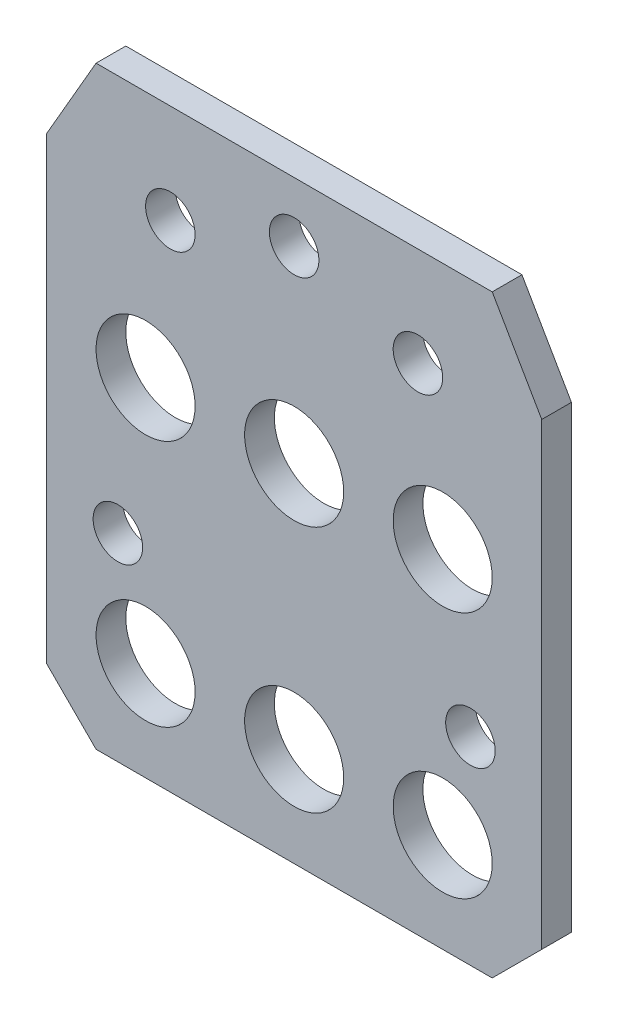
from build123d import *

# Parameters (mm, degrees)
SM_BASE_FLANGE_1_DEPTH = 3
CUT_EXTRUDE_1_REACH    = 41.166
SKETCH_6_R             = 2.5
CUT_EXTRUDE_2_REACH    = 41.166
SKETCH_7_R             = 5


# Sheet-metal steps are written as plain solids
with BuildPart() as part:
    # Sketch 1 → 基体-法兰1 (new body)
    with BuildSketch(Plane.XY):
        Polygon((20, -30), (14.284239003, -30), (-14.284239003, -30), (-20, -30), (-25, -25), (-25, 21.339745962), (-20, 30), (20, 30), (25, 21.339745962), (25, -25), align=None)
    extrude(amount=-SM_BASE_FLANGE_1_DEPTH)

    # 草图6 → 切除-拉伸1 (cut, up to next)
    with BuildSketch(Plane.XY, mode=Mode.PRIVATE) as cut_extrude_1_sk1:
        with Locations((0, 24)):
            Circle(SKETCH_6_R)
    cut_extrude_1_tool1 = extrude(cut_extrude_1_sk1.sketch, amount=-CUT_EXTRUDE_1_REACH, mode=Mode.PRIVATE) & part.part
    # 草图6 → 切除-拉伸1 (cut, up to next)
    with BuildSketch(Plane.XY, mode=Mode.PRIVATE) as cut_extrude_1_sk2:
        with Locations((-17.8, -10)):
            Circle(SKETCH_6_R)
    cut_extrude_1_tool2 = extrude(cut_extrude_1_sk2.sketch, amount=-CUT_EXTRUDE_1_REACH, mode=Mode.PRIVATE) & part.part
    # 草图6 → 切除-拉伸1 (cut, up to next)
    with BuildSketch(Plane.XY, mode=Mode.PRIVATE) as cut_extrude_1_sk3:
        with Locations((17.8, -10)):
            Circle(SKETCH_6_R)
    cut_extrude_1_tool3 = extrude(cut_extrude_1_sk3.sketch, amount=-CUT_EXTRUDE_1_REACH, mode=Mode.PRIVATE) & part.part
    # 草图6 → 切除-拉伸1 (cut, up to next)
    with BuildSketch(Plane.XY, mode=Mode.PRIVATE) as cut_extrude_1_sk4:
        with Locations((-12.5, 20)):
            Circle(SKETCH_6_R)
    cut_extrude_1_tool4 = extrude(cut_extrude_1_sk4.sketch, amount=-CUT_EXTRUDE_1_REACH, mode=Mode.PRIVATE) & part.part
    # 草图6 → 切除-拉伸1 (cut, up to next)
    with BuildSketch(Plane.XY, mode=Mode.PRIVATE) as cut_extrude_1_sk5:
        with Locations((12.5, 20)):
            Circle(SKETCH_6_R)
    cut_extrude_1_tool5 = extrude(cut_extrude_1_sk5.sketch, amount=-CUT_EXTRUDE_1_REACH, mode=Mode.PRIVATE) & part.part
    add(cut_extrude_1_tool1.solids().sort_by_distance((0, 24, 0))[0], mode=Mode.SUBTRACT)
    add(cut_extrude_1_tool2.solids().sort_by_distance((-17.8, -10, 0))[0], mode=Mode.SUBTRACT)
    add(cut_extrude_1_tool3.solids().sort_by_distance((17.8, -10, 0))[0], mode=Mode.SUBTRACT)
    add(cut_extrude_1_tool4.solids().sort_by_distance((-12.5, 20, 0))[0], mode=Mode.SUBTRACT)
    add(cut_extrude_1_tool5.solids().sort_by_distance((12.5, 20, 0))[0], mode=Mode.SUBTRACT)

    # 草图7 → 切除-拉伸2 (cut, up to next)
    with BuildSketch(Plane.XY, mode=Mode.PRIVATE) as cut_extrude_2_sk1:
        with Locations((-15, 5)):
            Circle(SKETCH_7_R)
    cut_extrude_2_tool1 = extrude(cut_extrude_2_sk1.sketch, amount=-CUT_EXTRUDE_2_REACH, mode=Mode.PRIVATE) & part.part
    # 草图7 → 切除-拉伸2 (cut, up to next)
    with BuildSketch(Plane.XY, mode=Mode.PRIVATE) as cut_extrude_2_sk2:
        with Locations((15, 5)):
            Circle(SKETCH_7_R)
    cut_extrude_2_tool2 = extrude(cut_extrude_2_sk2.sketch, amount=-CUT_EXTRUDE_2_REACH, mode=Mode.PRIVATE) & part.part
    # 草图7 → 切除-拉伸2 (cut, up to next)
    with BuildSketch(Plane.XY, mode=Mode.PRIVATE) as cut_extrude_2_sk3:
        with Locations((0, -20)):
            Circle(SKETCH_7_R)
    cut_extrude_2_tool3 = extrude(cut_extrude_2_sk3.sketch, amount=-CUT_EXTRUDE_2_REACH, mode=Mode.PRIVATE) & part.part
    # 草图7 → 切除-拉伸2 (cut, up to next)
    with BuildSketch(Plane.XY, mode=Mode.PRIVATE) as cut_extrude_2_sk4:
        with Locations((-15, -20)):
            Circle(SKETCH_7_R)
    cut_extrude_2_tool4 = extrude(cut_extrude_2_sk4.sketch, amount=-CUT_EXTRUDE_2_REACH, mode=Mode.PRIVATE) & part.part
    # 草图7 → 切除-拉伸2 (cut, up to next)
    with BuildSketch(Plane.XY, mode=Mode.PRIVATE) as cut_extrude_2_sk5:
        with Locations((15, -20)):
            Circle(SKETCH_7_R)
    cut_extrude_2_tool5 = extrude(cut_extrude_2_sk5.sketch, amount=-CUT_EXTRUDE_2_REACH, mode=Mode.PRIVATE) & part.part
    # 草图7 → 切除-拉伸2 (cut, up to next)
    with BuildSketch(Plane.XY, mode=Mode.PRIVATE) as cut_extrude_2_sk6:
        with Locations((0, 5)):
            Circle(SKETCH_7_R)
    cut_extrude_2_tool6 = extrude(cut_extrude_2_sk6.sketch, amount=-CUT_EXTRUDE_2_REACH, mode=Mode.PRIVATE) & part.part
    add(cut_extrude_2_tool1.solids().sort_by_distance((-15, 5, 0))[0], mode=Mode.SUBTRACT)
    add(cut_extrude_2_tool2.solids().sort_by_distance((15, 5, 0))[0], mode=Mode.SUBTRACT)
    add(cut_extrude_2_tool3.solids().sort_by_distance((0, -20, 0))[0], mode=Mode.SUBTRACT)
    add(cut_extrude_2_tool4.solids().sort_by_distance((-15, -20, 0))[0], mode=Mode.SUBTRACT)
    add(cut_extrude_2_tool5.solids().sort_by_distance((15, -20, 0))[0], mode=Mode.SUBTRACT)
    add(cut_extrude_2_tool6.solids().sort_by_distance((0, 5, 0))[0], mode=Mode.SUBTRACT)


solid = part.part
